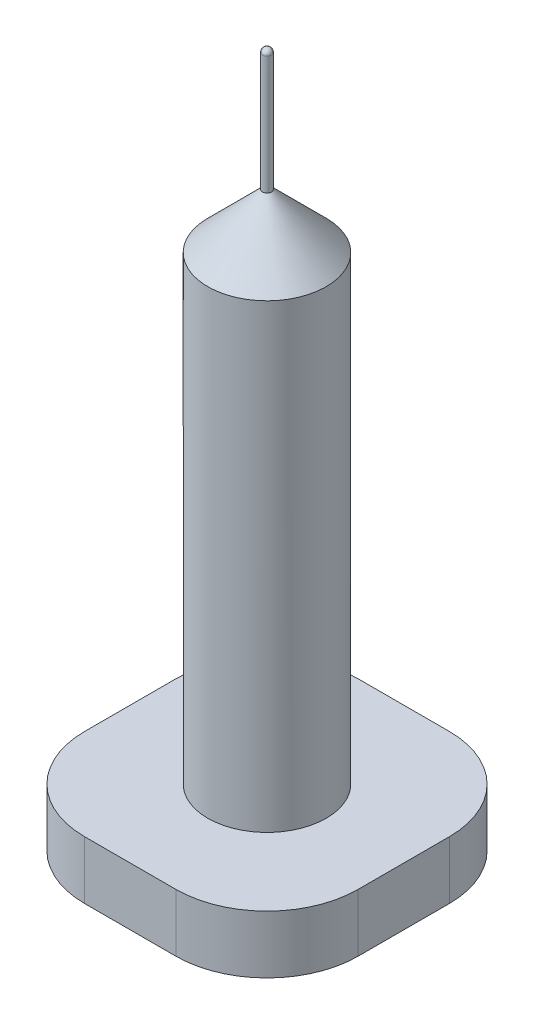
from build123d import *

# Parameters (mm, degrees)
SKETCH2_W           = 30
SKETCH2_H           = 30
BOSS_EXTRUDE1_DEPTH = 6.35
FILLET1_R           = 10
SKETCH3_R           = 6.5
BOSS_EXTRUDE2_DEPTH = 50
SKETCH4_R           = 0.5
BOSS_EXTRUDE3_DEPTH = 20
FILLET2_R           = 0.5
CHAMFER1_SIZE       = 6.5


with BuildPart() as part:
    # Sketch2 → Boss-Extrude1 (new body)
    with BuildSketch(Plane(origin=(0, 0, 0), x_dir=(1, 0, 0), z_dir=(0, 1, 0))):
        Rectangle(SKETCH2_W, SKETCH2_H)
    extrude(amount=BOSS_EXTRUDE1_DEPTH)

    # Fillet1
    fillet1_edges = [part.edges().sort_by_distance(p)[0] for p in [
        (-15, 3.175, 15),
        (-15, 3.175, -15),
        (15, 3.175, -15),
        (15, 3.175, 15),
    ]]
    fillet(fillet1_edges, radius=FILLET1_R)

    # Sketch3 → Boss-Extrude2 (add)
    with BuildSketch(Plane(origin=(0, 6.35, 0), x_dir=(1, 0, 0), z_dir=(0, 1, 0))):
        with Locations(Location((0, 0, 0), (0, 0, 270))):
            Circle(SKETCH3_R)
    extrude(amount=BOSS_EXTRUDE2_DEPTH)

    # Sketch4 → Boss-Extrude3 (add)
    with BuildSketch(Plane(origin=(0, 56.35, 0), x_dir=(1, 0, 0), z_dir=(0, 1, 0))):
        with Locations(Location((0, 0, 0), (0, 0, 270))):
            Circle(SKETCH4_R)
    extrude(amount=BOSS_EXTRUDE3_DEPTH)

    # Fillet2
    fillet2_edges = [part.edges().sort_by_distance(p)[0] for p in [
        (0, 76.35, -0.5),
    ]]
    fillet(fillet2_edges, radius=FILLET2_R)

    # Chamfer1
    # the kernel refuses this chamfer: 6.5 mm, written as the material it adds along each edge
    with BuildSketch(Plane(origin=(0, 56.35, 0), x_dir=(0, 0, 1), z_dir=(-1, 0, 0))) as chamfer1_piece_1_section:
        Polygon((0.5, CHAMFER1_SIZE), (0.5 + CHAMFER1_SIZE, 0), (0.5, 0), align=None)
    chamfer1_piece_1 = revolve(axis=Axis((0, 56.35, 0), (0, 1, 0)), mode=Mode.PRIVATE)
    chamfer1_piece_1 = chamfer1_piece_1 & Plane(origin=(0, 59.89101351, 0), x_dir=(0, 0, 1), z_dir=(0, -1, 0)) * Cylinder(6.5, 28, mode=Mode.PRIVATE)
    add(chamfer1_piece_1)


solid = part.part
